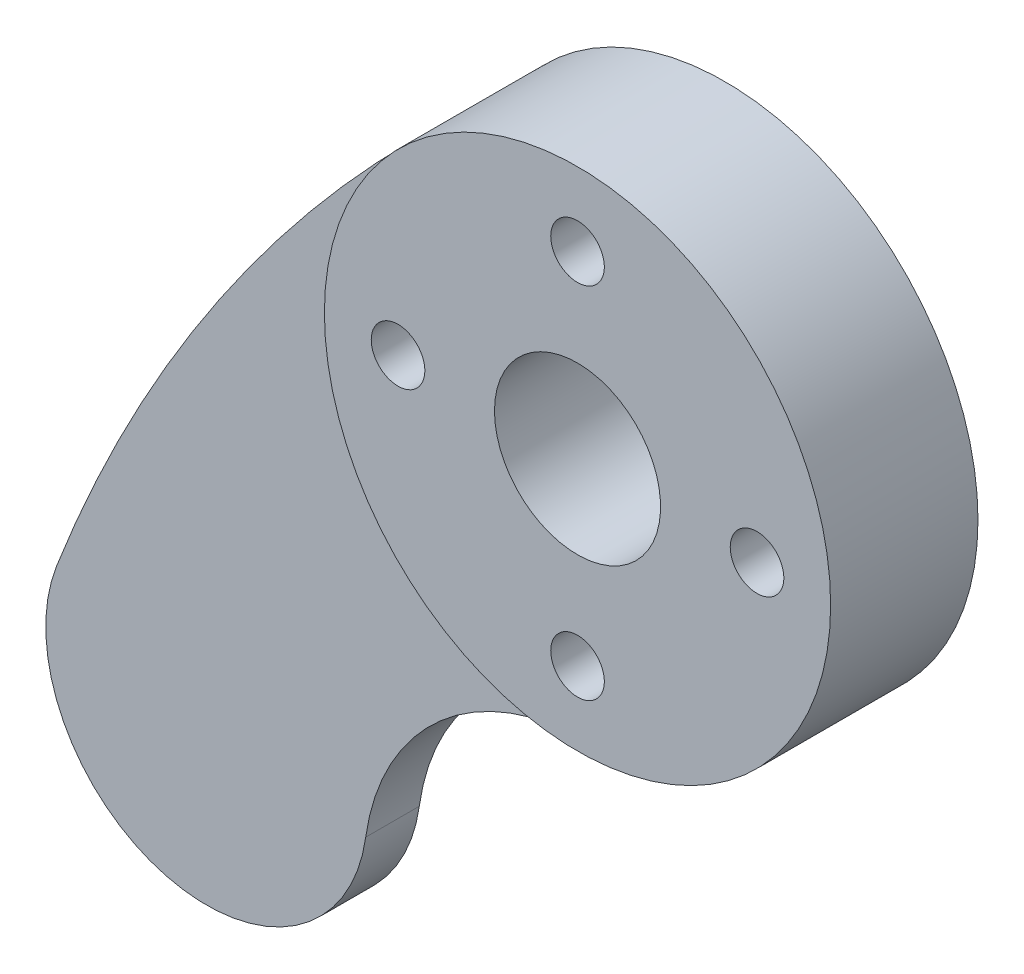
from build123d import *
from build123d.topology import SkipClean

# Parameters (mm, degrees)
BOSS_EXTRUDE1_DEPTH = 3.175
BOSS_EXTRUDE2_START = 3.81
SKETCH2_R           = 12
BOSS_EXTRUDE2_DEPTH = 3.81
SKETCH3_R           = 3.937
CUT_EXTRUDE1_DEPTH  = 134.099089527
SKETCH4_R           = 1.27
CUT_EXTRUDE2_DEPTH  = 134.099089527
CUT_EXTRUDE3_DEPTH  = 133.970273023
CUT_EXTRUDE4_START  = -0.635
CUT_EXTRUDE4_DEPTH  = 0.635


with BuildPart() as part:
    # Sketch1 → Boss-Extrude1 (new body)
    with BuildSketch(Plane.XY):
        with BuildLine():
            ThreePointArc((113.784062988, 44.416608597), (112.542436022, 60.902914722), (96.014300162, 60.502100346))
            ThreePointArc((96.014300162, 60.502100346), (86.225733854, 48.445051897), (79.156979953, 34.616777747))
            ThreePointArc((79.156979953, 34.616777747), (81.153408489, 26.227218543), (89.699693339, 25.073335615))
            ThreePointArc((89.699693339, 25.073335615), (102.758092485, 33.479680479), (113.784062988, 44.416608597))
        make_face()
    extrude(amount=BOSS_EXTRUDE1_DEPTH)

    # Sketch2 → Boss-Extrude2 (add)
    with SkipClean():  # the faces are left unmerged after this step: merging them gives an invalid solid
        with BuildSketch(Plane(origin=(0, 0, 0), x_dir=(-1, 0, 0), z_dir=(0, 0, -1)).offset(BOSS_EXTRUDE2_START)):
            with Locations((-104.48925, 52.0065)):
                Circle(SKETCH2_R)
        extrude(amount=-BOSS_EXTRUDE2_DEPTH)

    # Sketch3 → Cut-Extrude1 (cut, through all)
    with SkipClean():  # the faces are left unmerged after this step: merging them gives an invalid solid
        with BuildSketch(Plane(origin=(0, 0, -3.81), x_dir=(-1, 0, 0), z_dir=(0, 0, -1))):
            with Locations((-104.48925, 52.0065)):
                Circle(SKETCH3_R)
        extrude(amount=-CUT_EXTRUDE1_DEPTH, mode=Mode.SUBTRACT)

    # Sketch4 → Cut-Extrude2 (cut, through all)
    with SkipClean():  # the faces are left unmerged after this step: merging them gives an invalid solid
        with BuildSketch(Plane(origin=(0, 0, -3.81), x_dir=(-1, 0, 0), z_dir=(0, 0, -1))):
            with Locations((-95.98025, 52.0065)):
                Circle(SKETCH4_R)
            with Locations((-112.99825, 52.0065)):
                Circle(SKETCH4_R)
            with Locations((-104.48925, 43.4975)):
                Circle(SKETCH4_R)
            with Locations((-104.48925, 60.5155)):
                Circle(SKETCH4_R)
        extrude(amount=-CUT_EXTRUDE2_DEPTH, mode=Mode.SUBTRACT)

    # Sketch5 → Cut-Extrude3 (cut, through all)
    with SkipClean():  # the faces are left unmerged after this step: merging them gives an invalid solid
        with BuildSketch(Plane(origin=(0, 0, 0), x_dir=(-1, 0, 0), z_dir=(0, 0, -1))):
            with BuildLine():
                ThreePointArc((-104.430493989, 40.006643845), (-109.606684651, 41.15238269), (-113.7840634, 44.4166091))
                ThreePointArc((-113.7840634, 44.4166091), (-102.758092767, 33.479680706), (-89.699693406, 25.073335649))
                ThreePointArc((-89.699693406, 25.073335649), (-92.462895691, 27.440507008), (-93.81346398, 30.819079549))
                ThreePointArc((-93.81346398, 30.819079549), (-97.397477458, 37.40567327), (-104.430493989, 40.006643845))
            make_face()
        extrude(amount=-CUT_EXTRUDE3_DEPTH, mode=Mode.SUBTRACT)

    # Sketch6 → Cut-Extrude4 (cut)
    with SkipClean():  # the faces are left unmerged after this step: merging them gives an invalid solid
        with BuildSketch(Plane.XY.offset(3.175).offset(CUT_EXTRUDE4_START)):
            with BuildLine():
                ThreePointArc((96.014299675, 60.502099861), (86.225733771, 48.44505177), (79.156980092, 34.616778107))
                ThreePointArc((79.156980092, 34.616778107), (84.355854315, 24.500045491), (93.81346398, 30.819079549))
                ThreePointArc((93.81346398, 30.819079549), (97.397477458, 37.40567327), (104.430493989, 40.006643845))
                ThreePointArc((104.430493989, 40.006643845), (93.388711037, 47.448207038), (96.014299675, 60.502099861))
            make_face()
        extrude(amount=CUT_EXTRUDE4_DEPTH, mode=Mode.SUBTRACT)


solid = part.part
